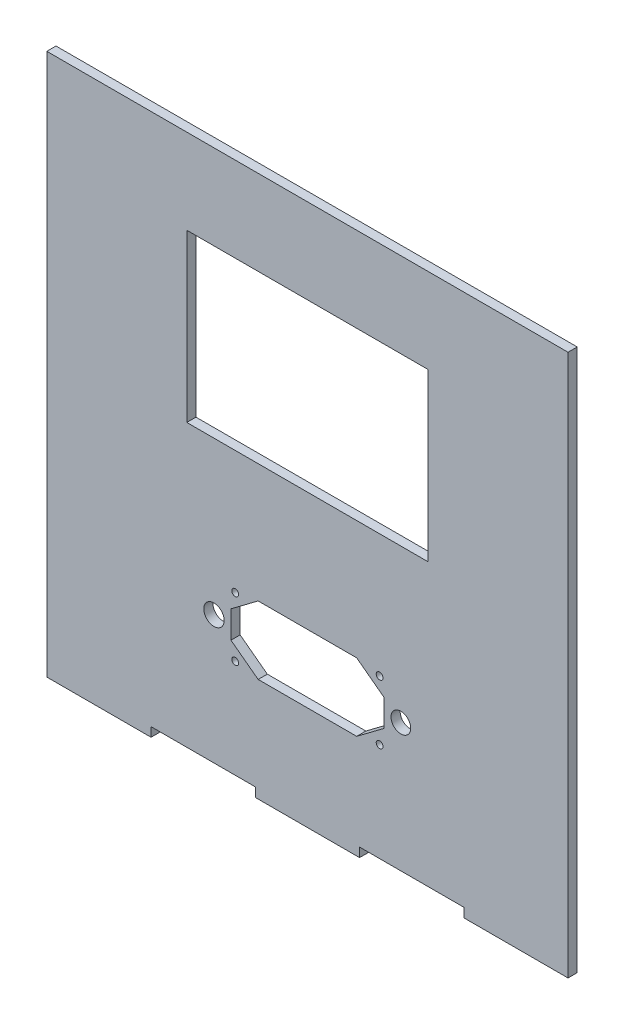
from build123d import *

# Parameters (mm, degrees)
SKETCH1_R           = 1
SKETCH1_R_2         = 3
SKETCH1_R_3         = 2.9
SKETCH1_W           = 71
SKETCH1_H           = 49
BOSS_EXTRUDE3_DEPTH = 2.7


with BuildPart() as part:
    # Sketch1 → Boss-Extrude3 (new body)
    with BuildSketch(Plane.XY):
        Polygon((-46.02, -28), (-46.02, -25.3), (-15.34, -25.3), (-15.34, -28), (15.34, -28), (15.34, -25.3), (46.02, -25.3), (46.02, -28), (76.7, -28), (76.7, -25.3), (76.7, -23), (76.7, 13), (76.7, 131.5), (-76.7, 131.5), (-76.7, 13), (-76.7, -23), (-76.7, -25.3), (-76.7, -28), align=None)
        with Locations((-21.25, 3.75)):
            Circle(SKETCH1_R, mode=Mode.SUBTRACT)
        with Locations((-27.5, 12.5)):
            Circle(SKETCH1_R_2, mode=Mode.SUBTRACT)
        with Locations((-21.25, 21.25)):
            Circle(SKETCH1_R, mode=Mode.SUBTRACT)
        with Locations((21.25, 3.75)):
            Circle(SKETCH1_R, mode=Mode.SUBTRACT)
        with Locations((27.5, 12.5)):
            Circle(SKETCH1_R_3, mode=Mode.SUBTRACT)
        with Locations((21.25, 21.25)):
            Circle(SKETCH1_R, mode=Mode.SUBTRACT)
        Polygon((-22.5, 16.5), (-14.5, 22.5), (14.5, 22.5), (22.5, 16.5), (22.5, 8.5), (14.5, 2.5), (0, 2.5), (-14.5, 2.5), (-22.5, 8.5), align=None, mode=Mode.SUBTRACT)
        with Locations((0, 82)):
            Rectangle(SKETCH1_W, SKETCH1_H, mode=Mode.SUBTRACT)
    extrude(amount=BOSS_EXTRUDE3_DEPTH)


solid = part.part
